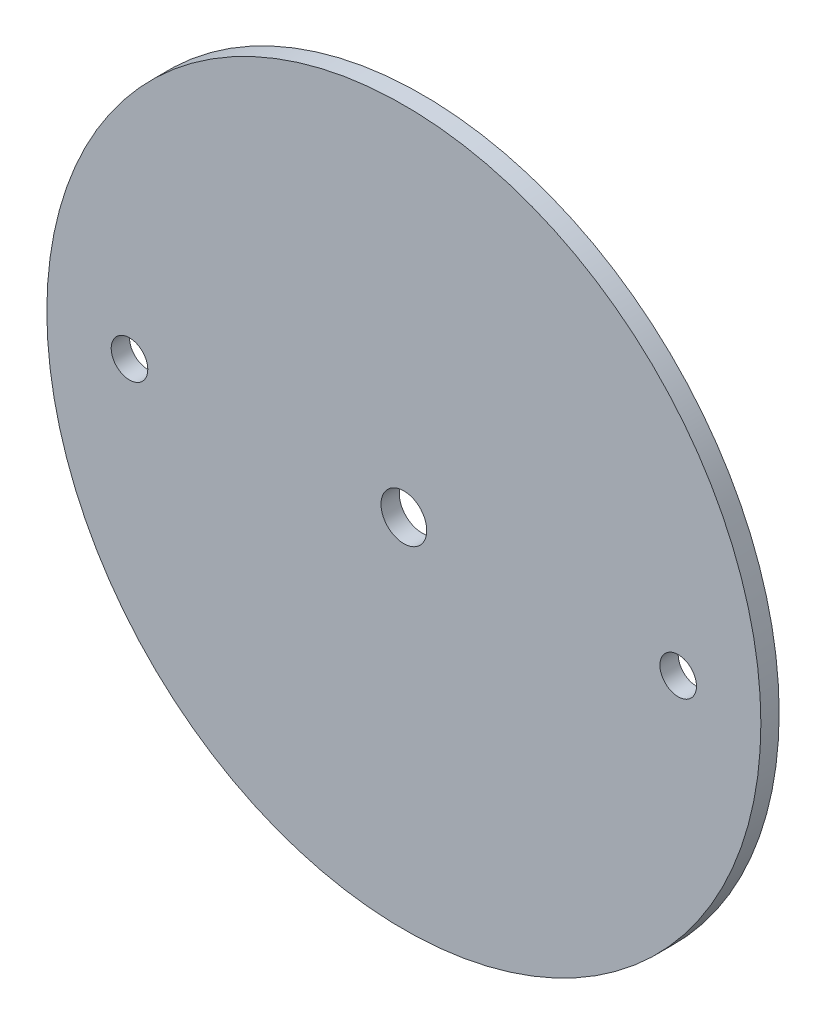
from build123d import *

# Parameters (mm, degrees)
SKETCH1_R                          = 61.976
BOSS_EXTRUDE1_DEPTH                = 1.5875
F_1_4_0_25_DIAMETER_HOLE1_D        = 6.35
F_5_16_0_3125_DIAMETER_HOLE1_D     = 7.9375
F_5_16_0_3125_DIAMETER_HOLE1_DEPTH = 3.302


with BuildPart() as part:
    # Sketch1 → Boss-Extrude1 (new, symmetric)
    with BuildSketch(Plane.XY):
        Circle(SKETCH1_R)
    extrude(amount=BOSS_EXTRUDE1_DEPTH, both=True)

    # 1/4 (0.25) Diameter Hole1 (through all)
    with Locations(Plane.XY.offset(1.5875)):
        with Locations((-47.625, 0), (47.625, 0)):
            Hole(F_1_4_0_25_DIAMETER_HOLE1_D / 2)

    # 5/16 (0.3125) Diameter Hole1
    with Locations(Plane.XY.offset(1.5875)):
        with Locations((0, 0)):
            Hole(F_5_16_0_3125_DIAMETER_HOLE1_D / 2, depth=F_5_16_0_3125_DIAMETER_HOLE1_DEPTH)


solid = part.part
